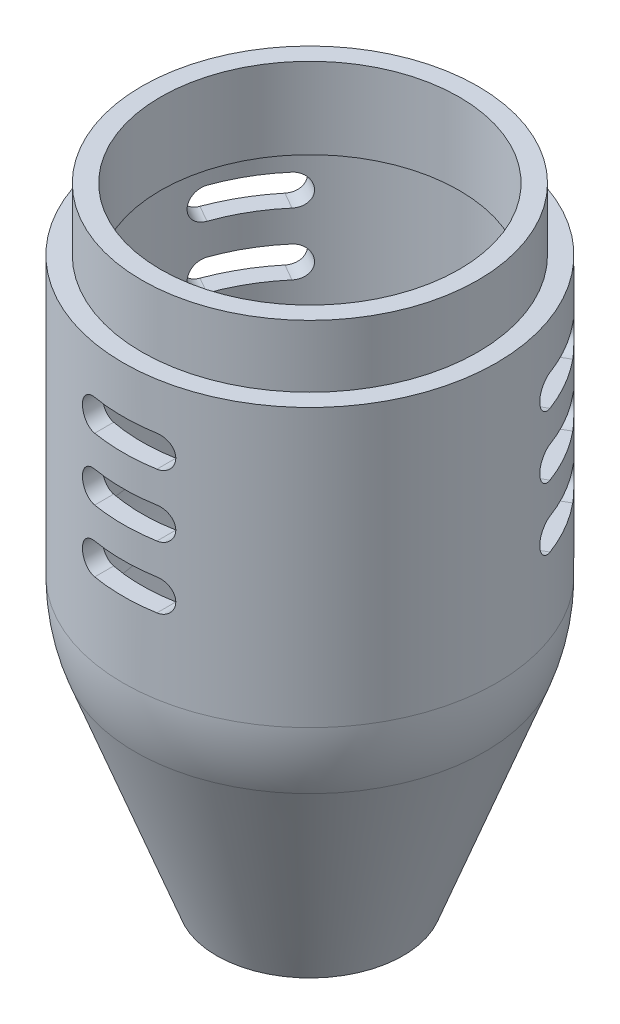
from build123d import *
from build123d.topology import SkipClean

# Parameters (mm, degrees)
CROQUIS2_R            = 27
CROQUIS2_R_2          = 24
EXTRUIR_L_MINA1_DEPTH = 10
CORTAR_EXTRUIR1_DEPTH = 109.627804912
MATRIZC1_COUNT        = 3


# Read off the part's stored shape, not the designer's step: Vaciado1
with BuildPart() as part:
    # Croquis1 → Revolución1 (revolve)
    with BuildSketch(Plane.XY, mode=Mode.PRIVATE) as revoluci_n1_sk:
        with BuildLine():
            Line((0, 0), (0, 90))
            Line((0, 90), (30, 90))
            Line((30, 90), (30, 45.440037453))
            ThreePointArc((30, 45.440037453), (29.518606503, 40.087293288), (28.089875327, 34.906334206))
            Line((28.089875327, 34.906334206), (15, 0))
            Line((15, 0), (0, 0))
        make_face()
    revolve(revoluci_n1_sk.sketch.rotate(Axis((0, 0, 0), (0, 1, 0)), 90), axis=Axis((0, 0, 0), (0, 1, 0)))

    # Croquis2 → Extruir-Lámina1 (add)
    with BuildSketch(Plane(origin=(0, 90, 0), x_dir=(-1, 0, 0), z_dir=(0, 1, 0))):
        Circle(CROQUIS2_R)
        Circle(CROQUIS2_R_2, mode=Mode.SUBTRACT)
    extrude(amount=EXTRUIR_L_MINA1_DEPTH)

    # Vaciado1 outline → Vaciado1 (revolve, cut)
    with SkipClean():  # the faces are left unmerged after this step: merging them gives an invalid solid
        with BuildSketch(Plane.XY):
            with BuildLine():
                Line((24, 87), (24, 90))
                Line((24, 90), (0, 90))
                Line((0, 90), (0, 0))
                Line((0, 0), (11.795998596, 0))
                Line((11.795998596, 0), (25.280887785, 35.959704505))
                ThreePointArc((25.280887785, 35.959704505), (26.566745853, 40.622567705), (27, 45.44003748))
                Line((27, 45.44003748), (27, 87))
                Line((27, 87), (24, 87))
            make_face()
        revolve(axis=Axis((0, 0, 0), (0, 1, 0)), mode=Mode.SUBTRACT)

    # Croquis3 → Cortar-Extruir1 (cut, through all)
    with SkipClean():  # the faces are left unmerged after this step: merging them gives an invalid solid
        with BuildSketch(Plane.XY):
            with BuildLine():
                Line((-5, 62.5), (5, 62.5))
                ThreePointArc((5, 62.5), (7.5, 60), (5, 57.5))
                Line((5, 57.5), (0, 57.5))
                Line((0, 57.5), (-5, 57.5))
                ThreePointArc((-5, 57.5), (-7.5, 60), (-5, 62.5))
            make_face()
            with BuildLine():
                Line((-5, 72.5), (5, 72.5))
                ThreePointArc((5, 72.5), (7.5, 70), (5, 67.5))
                Line((5, 67.5), (0, 67.5))
                Line((0, 67.5), (-5, 67.5))
                ThreePointArc((-5, 67.5), (-7.5, 70), (-5, 72.5))
            make_face()
            with BuildLine():
                Line((-5, 82.5), (5, 82.5))
                ThreePointArc((5, 82.5), (7.5, 80), (5, 77.5))
                Line((5, 77.5), (0, 77.5))
                Line((0, 77.5), (-5, 77.5))
                ThreePointArc((-5, 77.5), (-7.5, 80), (-5, 82.5))
            make_face()
        cortar_extruir1 = extrude(amount=CORTAR_EXTRUIR1_DEPTH, mode=Mode.SUBTRACT)

    # MatrizC1: Cortar-Extruir1 ×3 about axis
    with SkipClean():  # the faces are left unmerged after this step: merging them gives an invalid solid
        matrizc1_axis = Axis((0, 100, 0), (0, -1, 0))
        for i in range(1, MATRIZC1_COUNT):
            add(cortar_extruir1.rotate(matrizc1_axis, i * 360 / MATRIZC1_COUNT), mode=Mode.SUBTRACT)


solid = part.part
